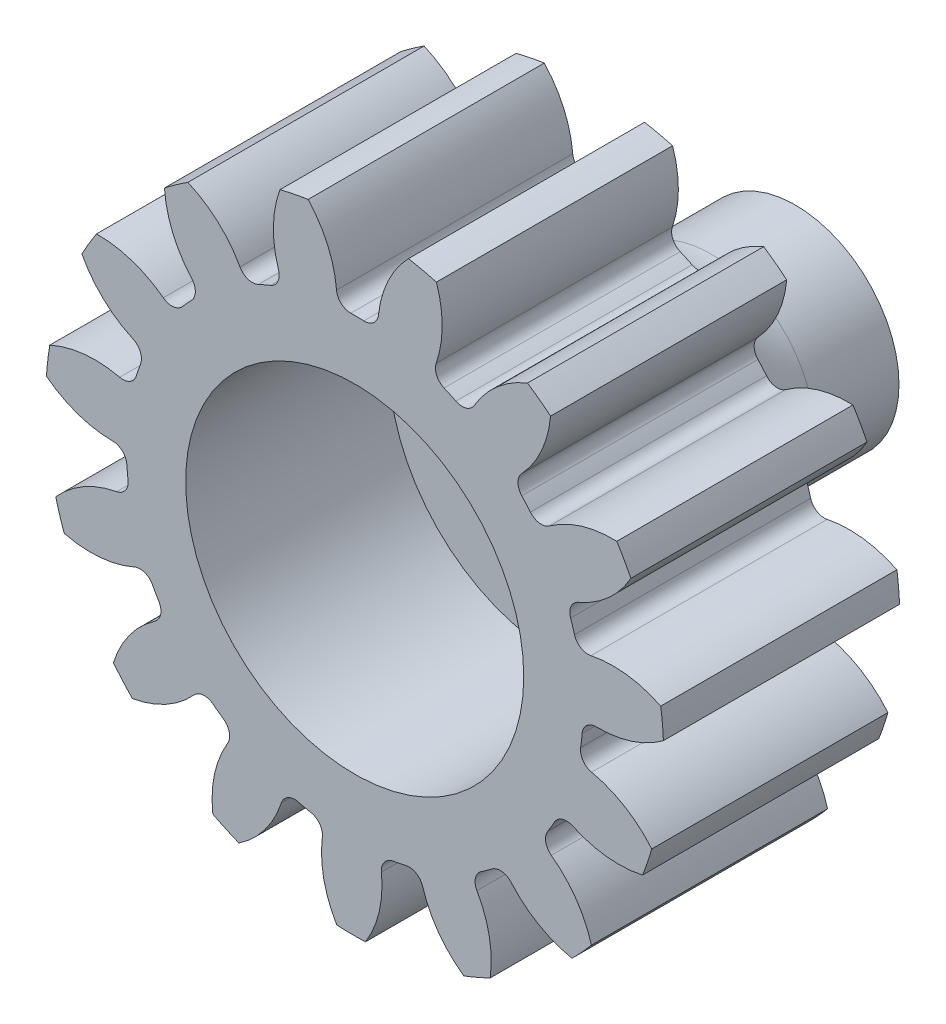
from build123d import *

# Parameters (mm, degrees)
SKETCH3_R          = 21.59
GEARBODY_DEPTH     = 11
TOOTHCUT_DEPTH     = 33.453908855
CIRPATTERN1_COUNT  = 15
SCALE1_SCALE_X     = 0.666666667
SCALE1_SCALE_Y     = 0.666666667
SCALE1_SCALE_Z     = 1
BOREDIA_R          = 7.874
BORE_DEPTH         = 12700
SKETCH5_R          = 4.1
CUT_EXTRUDE1_DEPTH = 5.3


with BuildPart() as part:
    # Sketch3 → gearBody (new body)
    with BuildSketch(Plane.XY):
        Circle(SKETCH3_R)
    extrude(amount=GEARBODY_DEPTH)

    # Sketch2 → toothCut (cut, through all)
    with BuildSketch(Plane.XY):
        with BuildLine():
            ThreePointArc((15.783846764, -2.304552616), (15.843293638, -1.852249483), (15.889781974, -1.39843136))
            ThreePointArc((15.889781974, -1.39843136), (16.213055843, -0.751556907), (16.890861518, -0.499501321))
            ThreePointArc((16.890861518, -0.499501321), (20.504912911, 0.340315353), (23.283949955, 2.798691365))
            ThreePointArc((23.283949955, 2.798691365), (23.292901215, -2.723187818), (22.010467945, -8.09409042))
            ThreePointArc((22.010467945, -8.09409042), (19.873444675, -5.060974685), (16.550574786, -3.410158156))
            ThreePointArc((16.550574786, -3.410158156), (15.949189176, -3.008551507), (15.783846764, -2.304552616))
        make_face()
    toothcut = extrude(amount=TOOTHCUT_DEPTH, mode=Mode.SUBTRACT)

    # CirPattern1: toothCut ×15 about axis
    cirpattern1_axis = Axis((0, 0, 11), (0, 0, -1))
    for i in range(1, CIRPATTERN1_COUNT):
        add(toothcut.rotate(cirpattern1_axis, i * 360 / CIRPATTERN1_COUNT), mode=Mode.SUBTRACT)


with BuildPart() as part_1:
    # Scale1: scaled about (0, 0, 5.5)
    add(part.part.scale((SCALE1_SCALE_X, SCALE1_SCALE_Y, SCALE1_SCALE_Z), about=(0, 0, 5.5)))

    # boreDia → bore (cut, symmetric)
    with BuildSketch(Plane.XY):
        Circle(BOREDIA_R)
    extrude(amount=BORE_DEPTH, both=True, mode=Mode.SUBTRACT)

    # Sketch4 → Revolve1 (revolve)
    with BuildSketch(Plane(origin=(0, 0, 0), x_dir=(0, 0, -1), z_dir=(1, 0, 0))):
        with BuildLine():
            Line((9.525, 0), (-1.524, 0))
            Line((-1.524, 0), (-1.524, 7.874))
            Line((-1.524, 7.874), (0, 7.874))
            Line((0, 7.874), (0, 10.414))
            ThreePointArc((0, 10.414), (1.636687307, 6.462687307), (5.588, 4.826))
            Line((5.588, 4.826), (9.525, 4.826))
            Line((9.525, 4.826), (9.525, 0))
        make_face()
    revolve(axis=Axis((0, 0, 0), (0, 0, -1)))

    # Sketch5 → Cut-Extrude1 (cut)
    with BuildSketch(Plane(origin=(0, 0, -9.525), x_dir=(-1, 0, 0), z_dir=(0, 0, -1))):
        Circle(SKETCH5_R)
    extrude(amount=-CUT_EXTRUDE1_DEPTH, mode=Mode.SUBTRACT)


solid = part_1.part
